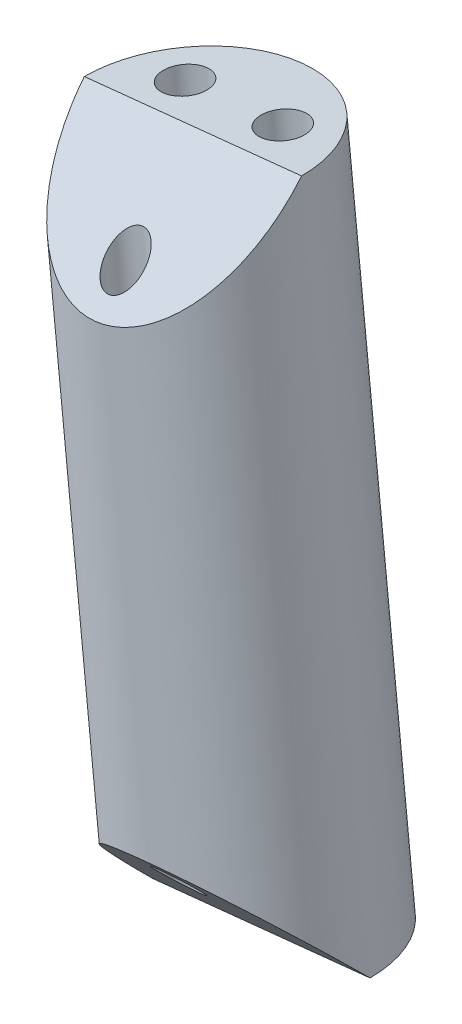
from build123d import *

# Parameters (mm, degrees)
SKETCH3_R               = 8
BOSS_EXTRUDE1_DEPTH     = 48.633157895
CUT_EXTRUDE1_DEPTH      = 200.187264303
CUT_EXTRUDE1_DEPTH_BACK = 200.187264303
CUT_EXTRUDE3_DEPTH      = 55.083471497
CUT_EXTRUDE3_DEPTH_BACK = 55.083471497
SKETCH8_R               = 1.4
SKETCH8_R_2             = 1.6


with BuildPart() as part:
    # Sketch3 → Boss-Extrude1 (new body)
    with BuildSketch(Plane(origin=(-20.344467381, 196.178792599, 0), x_dir=(-0.9946657577296572, -0.10315052302381678, 0), z_dir=(0.10315052302381678, -0.9946657577296572, 0))):
        with Locations((-10.431405186, 0)):
            Circle(SKETCH3_R)
    extrude(amount=BOSS_EXTRUDE1_DEPTH)

    # Sketch4 → Cut-Extrude1 (cut, two sides: drawn at the far end of the back side and taken through both)
    with BuildSketch(Plane(origin=(10.375761543, 1.076004901, 0), x_dir=(0.10315052302381672, -0.9946657577296572, 0), z_dir=(-0.9946657577296572, -0.10315052302381673, 0)).offset(-CUT_EXTRUDE1_DEPTH_BACK)):
        Polygon((-197.230869842, 0), (-189.230869842, 8), (-197.230869842, 8), align=None)
        Polygon((-156.597711947, 8), (-148.597711947, 8), (-148.597711947, 0), align=None)
    extrude(amount=CUT_EXTRUDE1_DEPTH + CUT_EXTRUDE1_DEPTH_BACK, mode=Mode.SUBTRACT)

    # Sketch8 → Cut-Extrude3 (cut, two sides: drawn at the far end of the back side and taken through both)
    with BuildSketch(Plane(origin=(-20.344467381, 196.178792599, 0), x_dir=(0.9946657577296572, 0.10315052302381678, 0), z_dir=(-0.10315052302381678, 0.9946657577296572, 0)).offset(-CUT_EXTRUDE3_DEPTH_BACK)):
        with Locations((10.431405186, -5.5)):
            Circle(SKETCH8_R)
        with Locations((6.831405186, 3)):
            Circle(SKETCH8_R_2)
        with Locations((14.031405186, 3)):
            Circle(SKETCH8_R_2)
    extrude(amount=CUT_EXTRUDE3_DEPTH + CUT_EXTRUDE3_DEPTH_BACK, mode=Mode.SUBTRACT)


solid = part.part
